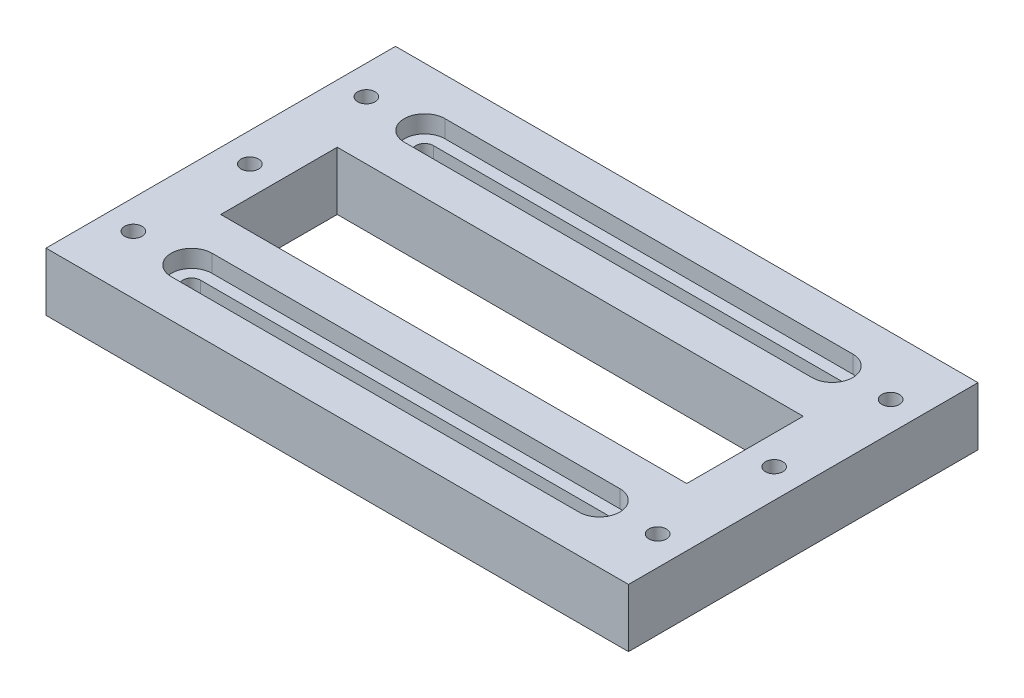
from build123d import *

# Parameters (mm, degrees)
SKETCH1_W           = 100
SKETCH1_H           = 60
SKETCH1_R           = 1.5
SKETCH1_W_2         = 80
SKETCH1_H_2         = 20
BOSS_EXTRUDE1_DEPTH = 10
CUT_EXTRUDE2_DEPTH  = 3


with BuildPart() as part:
    # Sketch1 → Boss-Extrude1 (new body)
    with BuildSketch(Plane(origin=(0, 0, 0), x_dir=(1, 0, 0), z_dir=(0, 1, 0))):
        with Locations((50, 30)):
            Rectangle(SKETCH1_W, SKETCH1_H)
        with Locations((5, 10)):
            Circle(SKETCH1_R, mode=Mode.SUBTRACT)
        with BuildLine():
            ThreePointArc((86.5, 10), (86.060660172, 8.939339828), (85, 8.5))
            Line((85, 8.5), (15, 8.5))
            ThreePointArc((15, 8.5), (13.5, 10), (15, 11.5))
            Line((15, 11.5), (85, 11.5))
            ThreePointArc((85, 11.5), (86.060660172, 11.060660172), (86.5, 10))
        make_face(mode=Mode.SUBTRACT)
        with Locations((95, 10)):
            Circle(SKETCH1_R, mode=Mode.SUBTRACT)
        with Locations((50, 30)):
            Rectangle(SKETCH1_W_2, SKETCH1_H_2, mode=Mode.SUBTRACT)
        with Locations((5, 30)):
            Circle(SKETCH1_R, mode=Mode.SUBTRACT)
        with Locations((5, 50)):
            Circle(SKETCH1_R, mode=Mode.SUBTRACT)
        with Locations((95, 30)):
            Circle(SKETCH1_R, mode=Mode.SUBTRACT)
        with BuildLine():
            Line((15, 51.5), (85, 51.5))
            ThreePointArc((85, 51.5), (86.060660172, 51.060660172), (86.5, 50))
            ThreePointArc((86.5, 50), (86.060660172, 48.939339828), (85, 48.5))
            Line((85, 48.5), (15, 48.5))
            ThreePointArc((15, 48.5), (13.5, 50), (15, 51.5))
        make_face(mode=Mode.SUBTRACT)
        with Locations((95, 50)):
            Circle(SKETCH1_R, mode=Mode.SUBTRACT)
    extrude(amount=BOSS_EXTRUDE1_DEPTH)

    # Sketch3 → Cut-Extrude2 (cut)
    with BuildSketch(Plane(origin=(0, 10, 0), x_dir=(1, 0, 0), z_dir=(0, 1, 0))):
        with BuildLine():
            Line((15, 46.5), (85, 46.5))
            ThreePointArc((85, 46.5), (88.5, 50), (85, 53.5))
            Line((85, 53.5), (15, 53.5))
            ThreePointArc((15, 53.5), (11.5, 50), (15, 46.5))
        make_face()
        with BuildLine():
            Line((15, 6.5), (85, 6.5))
            ThreePointArc((85, 6.5), (88.5, 10), (85, 13.5))
            Line((85, 13.5), (15, 13.5))
            ThreePointArc((15, 13.5), (11.5, 10), (15, 6.5))
        make_face()
    extrude(amount=-CUT_EXTRUDE2_DEPTH, mode=Mode.SUBTRACT)


solid = part.part
